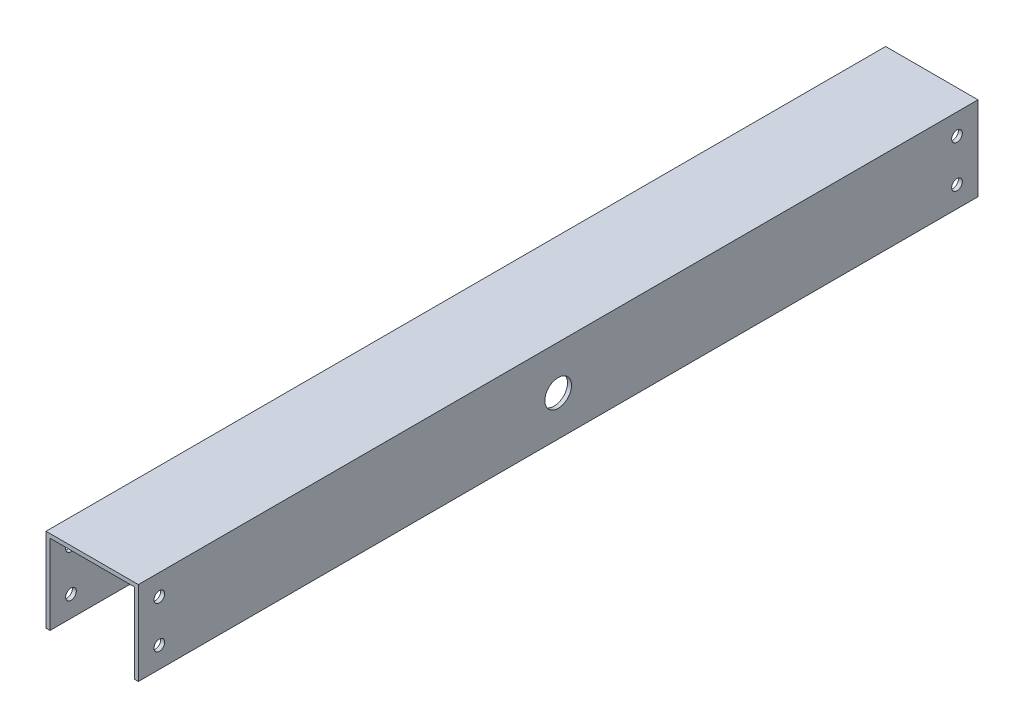
from build123d import *

# Parameters (mm, degrees)
SALIENTE_EXTRUIR1_DEPTH = 500
CROQUIS4_R              = 15.875
CORTAR_EXTRUIR1_DEPTH   = 521.74003246
CROQUIS5_R              = 6.35
CORTAR_EXTRUIR2_DEPTH   = 160


with BuildPart() as part:
    # Croquis1 → Saliente-Extruir1 (new, symmetric)
    with BuildSketch(Plane.XY):
        Polygon((0, 0), (50.2375, 0), (50.2375, -95.2375), (55, -95.2375), (55, 4.7625), (0, 4.7625), (-55, 4.7625), (-55, -95.2375), (-50.2375, -95.2375), (-50.2375, 0), align=None)
    extrude(amount=SALIENTE_EXTRUIR1_DEPTH, both=True)

    # Croquis4 → Cortar-Extruir1 (cut, through all)
    with BuildSketch(Plane(origin=(55, 0, 0), x_dir=(0, 0, -1), z_dir=(1, 0, 0))):
        with Locations((0, -47.6175)):
            Circle(CROQUIS4_R)
    extrude(amount=-CORTAR_EXTRUIR1_DEPTH, mode=Mode.SUBTRACT)

    # Croquis5 → Cortar-Extruir2 (cut)
    with BuildSketch(Plane(origin=(55, 0, 0), x_dir=(0, 0, -1), z_dir=(1, 0, 0))):
        with Locations((-475, -20.2375)):
            Circle(CROQUIS5_R)
        with Locations((-475, -70.2375)):
            Circle(CROQUIS5_R)
        with Locations((475, -70.2375)):
            Circle(CROQUIS5_R)
        with Locations((475, -20.2375)):
            Circle(CROQUIS5_R)
    extrude(amount=-CORTAR_EXTRUIR2_DEPTH, mode=Mode.SUBTRACT)


solid = part.part
